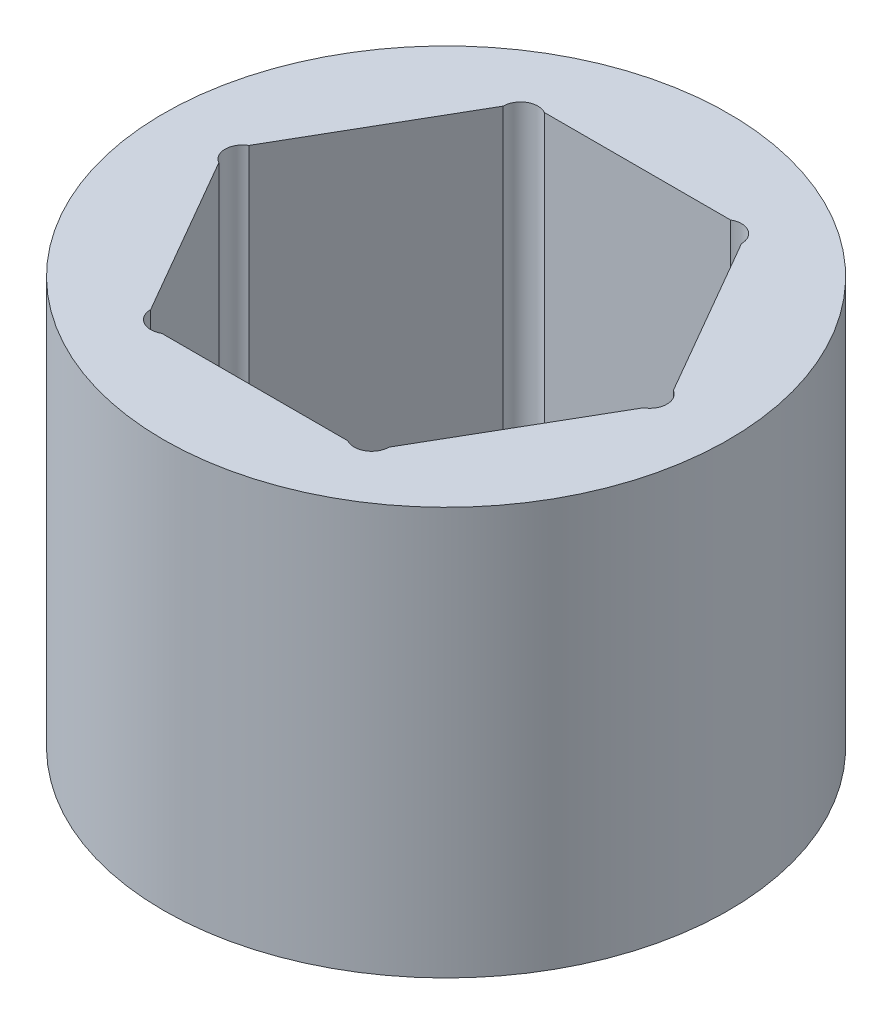
from build123d import *

# Parameters (mm, degrees)
SKETCH1_R           = 9.7536
BOSS_EXTRUDE1_DEPTH = 14.0716


with BuildPart() as part:
    # Sketch1 → Boss-Extrude1 (new body)
    with BuildSketch(Plane(origin=(0, 0, 0), x_dir=(1, 0, 0), z_dir=(0, 1, 0))):
        Circle(SKETCH1_R)
        with BuildLine():
            ThreePointArc((3.812821178, 6.604), (4.03243642, 6.384384758), (4.112821178, 6.084384758))
            Line((4.112821178, 6.084384758), (7.325642355, 0.519615242))
            ThreePointArc((7.325642355, 0.519615242), (7.545257598, 0.3), (7.625642355, 0))
            ThreePointArc((7.625642355, 0), (7.545257598, -0.3), (7.325642355, -0.519615242))
            Line((7.325642355, -0.519615242), (4.112821178, -6.084384758))
            ThreePointArc((4.112821178, -6.084384758), (4.03243642, -6.384384758), (3.812821178, -6.604))
            ThreePointArc((3.812821178, -6.604), (3.512821178, -6.684384758), (3.212821178, -6.604))
            Line((3.212821178, -6.604), (-3.212821178, -6.604))
            ThreePointArc((-3.212821178, -6.604), (-3.512821178, -6.684384758), (-3.812821178, -6.604))
            ThreePointArc((-3.812821178, -6.604), (-4.03243642, -6.384384758), (-4.112821178, -6.084384758))
            Line((-4.112821178, -6.084384758), (-7.325642355, -0.519615242))
            ThreePointArc((-7.325642355, -0.519615242), (-7.545257598, -0.3), (-7.625642355, 0))
            ThreePointArc((-7.625642355, 0), (-7.545257598, 0.3), (-7.325642355, 0.519615242))
            Line((-7.325642355, 0.519615242), (-4.112821178, 6.084384758))
            ThreePointArc((-4.112821178, 6.084384758), (-4.03243642, 6.384384758), (-3.812821178, 6.604))
            ThreePointArc((-3.812821178, 6.604), (-3.512821178, 6.684384758), (-3.212821178, 6.604))
            Line((-3.212821178, 6.604), (3.212821178, 6.604))
            ThreePointArc((3.212821178, 6.604), (3.512821178, 6.684384758), (3.812821178, 6.604))
        make_face(mode=Mode.SUBTRACT)
    extrude(amount=BOSS_EXTRUDE1_DEPTH)


solid = part.part
